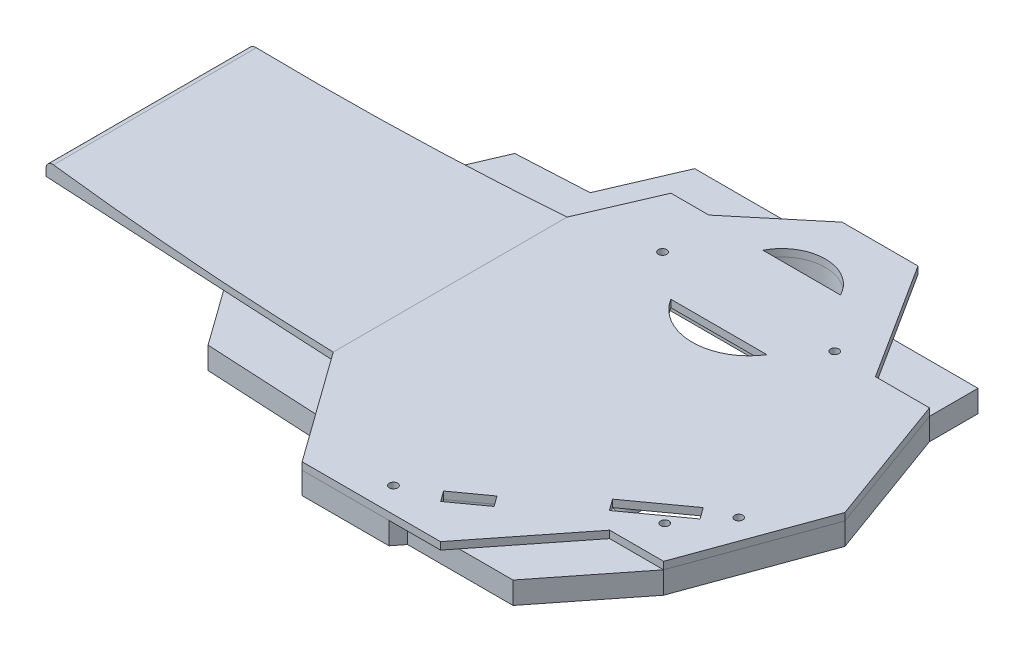
from build123d import *

# Parameters (mm, degrees)
EXTRUDE_1_DEPTH               = 2
EXTRUDE_2_DEPTH               = 2
CUT_EXTRUDE_3_DEPTH           = 202.869395429
CUT_EXTRUDE_3_DEPTH_BACK      = 202.869395429
FILLET_1_R                    = 2
EXTRUDE_4_DEPTH               = 6
CUT_EXTRUDE_7_DEPTH           = 202.98824919
CUT_EXTRUDE_8_DEPTH           = 202.98824919
SKETCH_26_W                   = 1.1303
SKETCH_26_H                   = 10
SKETCH_29_R                   = 3.1
EXTRUDE_14_DEPTH              = 6
EXTRUDE_14_2_DEPTH            = 6
EXTRUDE_14_3_DEPTH            = 6
EXTRUDE_14_4_DEPTH            = 6
SKETCH_32_W                   = 1.1303
SKETCH_32_H                   = 8
HOLE_WIZARD_4_40_4_AT_2_COUNT = 2
HOLE_WIZARD_4_40_4_AT_2_PITCH = 46.853089657
SKETCH_35_W                   = 1.1303
SKETCH_35_H                   = 8
HOLE_WIZARD_4_40_5_AT_2_COUNT = 2
HOLE_WIZARD_4_40_5_AT_2_PITCH = 67.324981434


with BuildPart() as part:
    # 草图2 → 凸台-拉伸1 (new body)
    with BuildSketch(Plane(origin=(0, 0, 0), x_dir=(1, 0, 0), z_dir=(0, 1, 0))):
        Polygon((141.821582241, 68.082690978), (121.161879345, 68.082690978), (101.35099463, 51.608897425), (91.039832206, 51.608897425), (82.527346571, 31.825074964), (0, 27.5), (0, -27.5), (82.527346571, -31.825074964), (104.14664553, -61.917309022), (141.821582241, -61.917309022), (162.133732132, -36.18552755), (176.829545061, -36.18552755), (190, 0), (176.829545061, 36.18552755), (162.133732132, 36.18552755), align=None)
    extrude(amount=EXTRUDE_1_DEPTH)

    # 草图6 → 凸台-拉伸2 (add)
    with BuildSketch(Plane(origin=(0, 2, 0), x_dir=(1, 0, 0), z_dir=(0, 1, 0))):
        Polygon((82.527346571, 31.825074964), (82.527346571, -31.825074964), (0, -27.5), (0, 27.5), align=None)
    extrude(amount=EXTRUDE_2_DEPTH)

    # 草图7 → 切除-拉伸3 (cut, two sides: drawn at the far end of the back side and taken through both)
    with BuildSketch(Plane.XY.offset(-CUT_EXTRUDE_3_DEPTH_BACK)):
        with BuildLine():
            Line((82.527346571, 2), (82.527346571, 30.740821148))
            Line((82.527346571, 30.740821148), (0, 4))
            add(Edge.make_bspline(
                [(82.527346571, 2), (41.215261335, 1.001172546), (0, 4)],
                knots=[0, 0, 0, 1, 1, 1], degree=2))
        make_face()
    extrude(amount=CUT_EXTRUDE_3_DEPTH + CUT_EXTRUDE_3_DEPTH_BACK, mode=Mode.SUBTRACT)

    # 圆角1
    fillet_1_edges = [part.edges().sort_by_distance(p)[0] for p in [
        (0, 4, 13.75),
    ]]
    fillet(fillet_1_edges, radius=FILLET_1_R)


with BuildPart() as body_2:
    # 草图13 → 凸台-拉伸4 (new body)
    with BuildSketch(Plane.XZ):
        Polygon((53.501507434, -30.303895193), (58.412275987, -41.716986195), (77.926898746, -42.739704237), (86.484415452, -62.62818317), (136.164724768, -62.62818317), (144.584081331, -49.40685536), (176.829545061, -49.40685536), (176.829545061, -36.18552755), (190, 0), (176.829545061, 36.18552755), (158.743204348, 59.097615602), (130.016377906, 59.097615602), (127.790568727, 61.917309022), (104.14664553, 61.917309022), (93.336996051, 46.871191993), (61.845926158, 45.220814953), (51.036276678, 30.174697924), (82.527346571, 31.825074964), (171.852914921, 31.825074964), (171.852914921, -31.825074964), (82.527346571, -31.825074964), align=None)
    extrude(amount=EXTRUDE_4_DEPTH)


with BuildPart() as cut_extrude_7_tool:
    # 草图18 → 切除-拉伸7 (new, through all)
    with BuildSketch(Plane(origin=(0, 2, 0), x_dir=(1, 0, 0), z_dir=(0, 1, 0))):
        Polygon((169.563862496, -18.125868021), (155.218286362, -28.471875769), (157.463858458, -31.585543016), (171.809434591, -21.239535267), align=None)
        Polygon((130.302091903, -49.564637909), (132.361562224, -52.420260001), (140.814695434, -46.323873151), (138.755225113, -43.468251059), align=None)
    extrude(amount=-CUT_EXTRUDE_7_DEPTH)


with BuildPart() as part_1:
    add(part.part)

    # 切除-拉伸7: cut by cut_extrude_7_tool
    add(cut_extrude_7_tool.part, mode=Mode.SUBTRACT)


with BuildPart() as body_2_1:
    add(body_2.part)

    # 切除-拉伸7: cut by cut_extrude_7_tool
    add(cut_extrude_7_tool.part, mode=Mode.SUBTRACT)


with BuildPart() as cut_extrude_8_tool:
    # 草图17 → 切除-拉伸8 (new, through all)
    with BuildSketch(Plane(origin=(0, 2, 0), x_dir=(1, 0, 0), z_dir=(0, 1, 0))):
        with BuildLine():
            Line((142.181150975, 26.59529287), (116.011181983, 26.59529287))
            ThreePointArc((116.011181983, 26.59529287), (129.096166479, 19.355270398), (142.181150975, 26.59529287))
        make_face()
        with BuildLine():
            Line((116.98958299, 50.681307574), (138.127410429, 50.681307574))
            ThreePointArc((138.127410429, 50.681307574), (127.55849671, 57.129732827), (116.98958299, 50.681307574))
        make_face()
    extrude(amount=-CUT_EXTRUDE_8_DEPTH)


with BuildPart() as part_2:
    add(part_1.part)

    # 切除-拉伸8: cut by cut_extrude_8_tool
    add(cut_extrude_8_tool.part, mode=Mode.SUBTRACT)

    # 草图26 → #4-40 螺纹孔3 (revolve, cut)
    with BuildSketch(Plane(origin=(168.015540482, 4, 27.047622993), x_dir=(0, 0, 1), z_dir=(1, 0, 0))):
        with Locations((0.56515, 5)):
            Rectangle(SKETCH_26_W, SKETCH_26_H)
    revolve(axis=Axis((168.015540482, 10.35, 27.047622993), (0, -1, 0)), mode=Mode.SUBTRACT)


with BuildPart() as body_2_2:
    add(body_2_1.part)

    # 切除-拉伸8: cut by cut_extrude_8_tool
    add(cut_extrude_8_tool.part, mode=Mode.SUBTRACT)


with BuildPart() as body_3:
    # 草图29 → 凸台-拉伸14 (new body)
    with BuildSketch(Plane.XZ):
        with Locations((85.179418504, -19.707526605)):
            Circle(SKETCH_29_R)
    extrude(amount=EXTRUDE_14_DEPTH)


with BuildPart() as body_4:
    # 草图29 → Extrude 14 2 (new body)
    with BuildSketch(Plane.XZ):
        with Locations((150.788762168, -19.707526605)):
            Circle(SKETCH_29_R)
    extrude(amount=EXTRUDE_14_2_DEPTH)


with BuildPart() as body_5:
    # 草图29 → Extrude 14 3 (new body)
    with BuildSketch(Plane.XZ):
        with Locations((150.788762168, 19.707526605)):
            Circle(SKETCH_29_R)
    extrude(amount=EXTRUDE_14_3_DEPTH)


with BuildPart() as body_6:
    # 草图29 → Extrude 14 4 (new body)
    with BuildSketch(Plane.XZ):
        with Locations((85.179418504, 19.707526605)):
            Circle(SKETCH_29_R)
    extrude(amount=EXTRUDE_14_4_DEPTH)


with BuildPart() as hole_wizard_4_40_4_tool:
    # 草图32 → #4-40 螺纹孔4 (revolve)
    with BuildSketch(Plane(origin=(150.602455899, 2, -36.6082143), x_dir=(0, 0, 1), z_dir=(1, 0, 0))):
        with Locations((0.56515, 4)):
            Rectangle(SKETCH_32_W, SKETCH_32_H)
    hole_wizard_4_40_4 = revolve(axis=Axis((150.602455899, 8.35, -36.6082143), (0, -1, 0)))


with BuildPart() as part_3:
    add(part_2.part)

    # #4-40 螺纹孔4: cut by hole_wizard_4_40_4_tool
    add(hole_wizard_4_40_4_tool.part, mode=Mode.SUBTRACT)


with BuildPart() as body_2_3:
    add(body_2_2.part)

    # #4-40 螺纹孔4: cut by hole_wizard_4_40_4_tool
    add(hole_wizard_4_40_4_tool.part, mode=Mode.SUBTRACT)


with BuildPart() as hole_wizard_4_40_4_at_2_tool:
    # #4-40 螺纹孔4 at 2: #4-40 螺纹孔4 ×2
    with Locations(*[(-i * HOLE_WIZARD_4_40_4_AT_2_PITCH, 0, 0) for i in range(1, HOLE_WIZARD_4_40_4_AT_2_COUNT)]):
        add(hole_wizard_4_40_4)


with BuildPart() as part_4:
    add(part_3.part)

    # #4-40 螺纹孔4 at 2: cut by hole_wizard_4_40_4_at_2_tool
    add(hole_wizard_4_40_4_at_2_tool.part, mode=Mode.SUBTRACT)


with BuildPart() as body_2_4:
    add(body_2_3.part)

    # #4-40 螺纹孔4 at 2: cut by hole_wizard_4_40_4_at_2_tool
    add(hole_wizard_4_40_4_at_2_tool.part, mode=Mode.SUBTRACT)


with BuildPart() as hole_wizard_4_40_5_tool:
    # 草图35 → #4-40 螺纹孔5 (revolve)
    with BuildSketch(Plane(origin=(176.735584933, 2, 15.639737001), x_dir=(0, 0, 1), z_dir=(1, 0, 0))):
        with Locations((0.56515, 4)):
            Rectangle(SKETCH_35_W, SKETCH_35_H)
    hole_wizard_4_40_5 = revolve(axis=Axis((176.735584933, 8.35, 15.639737001), (0, -1, 0)))


with BuildPart() as part_5:
    add(part_4.part)

    # #4-40 螺纹孔5: cut by hole_wizard_4_40_5_tool
    add(hole_wizard_4_40_5_tool.part, mode=Mode.SUBTRACT)


with BuildPart() as body_2_5:
    add(body_2_4.part)

    # #4-40 螺纹孔5: cut by hole_wizard_4_40_5_tool
    add(hole_wizard_4_40_5_tool.part, mode=Mode.SUBTRACT)


with BuildPart() as hole_wizard_4_40_5_at_2_tool:
    # #4-40 螺纹孔5 at 2: #4-40 螺纹孔5 ×2
    with Locations(*[Vector(-0.8103060721730659, 0, 0.5860068851126735) * (i * HOLE_WIZARD_4_40_5_AT_2_PITCH) for i in range(1, HOLE_WIZARD_4_40_5_AT_2_COUNT)]):
        add(hole_wizard_4_40_5)


with BuildPart() as part_6:
    add(part_5.part)

    # #4-40 螺纹孔5 at 2: cut by hole_wizard_4_40_5_at_2_tool
    add(hole_wizard_4_40_5_at_2_tool.part, mode=Mode.SUBTRACT)


with BuildPart() as body_2_6:
    add(body_2_5.part)

    # #4-40 螺纹孔5 at 2: cut by hole_wizard_4_40_5_at_2_tool
    add(hole_wizard_4_40_5_at_2_tool.part, mode=Mode.SUBTRACT)


solid = Compound([body_3.part, body_4.part, body_5.part, body_6.part, part_6.part, body_2_6.part])
